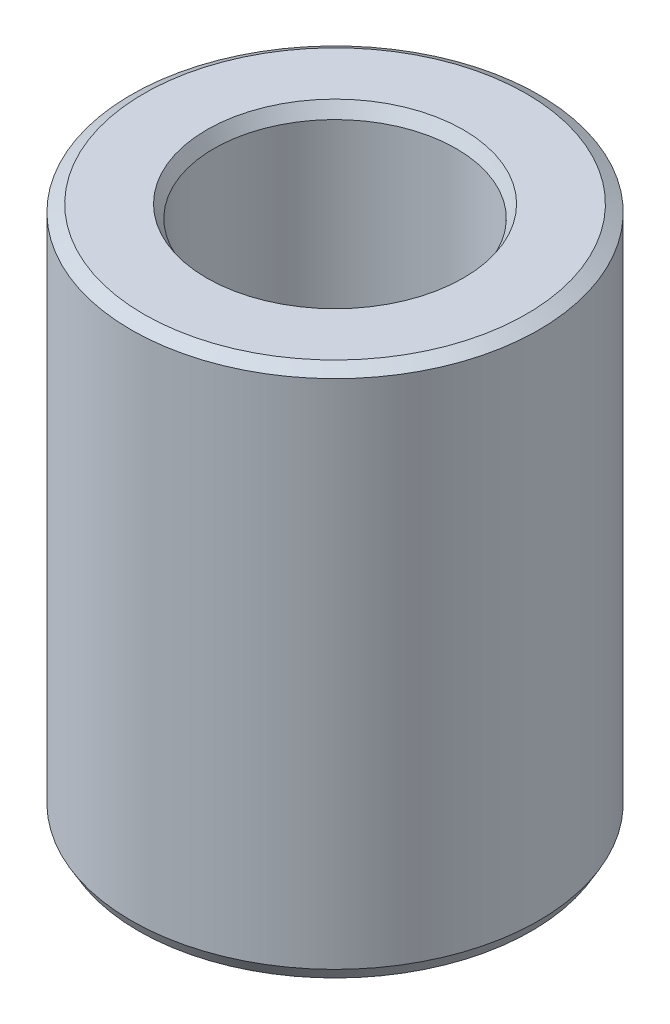
from build123d import *
from OCP.BRepFilletAPI import BRepFilletAPI_MakeChamfer

# Parameters (mm, degrees)
SKETCH1_R           = 60
BOSS_EXTRUDE1_DEPTH = 156.482173439
SKETCH2_R           = 35.663641277
CUT_EXTRUDE1_DEPTH  = 179.007501539
CHAMFER1_SIZE       = 2.138744909
CHAMFER1_SIZE2      = 3.704414846


with BuildPart() as part:
    # Sketch1 → Boss-Extrude1 (new body)
    with BuildSketch(Plane(origin=(0, 0, 0), x_dir=(1, 0, 0), z_dir=(0, 1, 0))):
        Circle(SKETCH1_R)
    extrude(amount=BOSS_EXTRUDE1_DEPTH)

    # Sketch2 → Cut-Extrude1 (cut, through all)
    with BuildSketch(Plane(origin=(0, 0, 0), x_dir=(1, 0, 0), z_dir=(0, 1, 0))):
        Circle(SKETCH2_R)
    extrude(amount=CUT_EXTRUDE1_DEPTH, mode=Mode.SUBTRACT)

    # Chamfer1: one chamfer whose edges measure the first distance from different faces: ONE call of the kernel's chamfer builder (chamfer() names one face for all edges)
    chamfer1_edges_1 = [part.edges().sort_by_distance(p)[0] for p in [
        (-35.663641277, 156.482173439, 0),
    ]]
    chamfer1_side_1 = [part.faces().sort_by_distance(p)[0] for p in [
        (-58.302943725, 156.482173439, 0),
    ]]
    chamfer1_edges_2 = [part.edges().sort_by_distance(p)[0] for p in [
        (-35.663641277, 0, 0),
    ]]
    chamfer1_side_2 = [part.faces().sort_by_distance(p)[0] for p in [
        (-35.663641277, 78.241086719, 0),
    ]]
    chamfer1_edges_3 = [part.edges().sort_by_distance(p)[0] for p in [
        (-60, 0, 0),
    ]]
    chamfer1_side_3 = [part.faces().sort_by_distance(p)[0] for p in [
        (-58.302943725, 0, 0),
    ]]
    chamfer1_edges_4 = [part.edges().sort_by_distance(p)[0] for p in [
        (-60, 156.482173439, 0),
    ]]
    chamfer1_side_4 = [part.faces().sort_by_distance(p)[0] for p in [
        (-60, 78.241086719, 0),
    ]]
    chamfer1 = BRepFilletAPI_MakeChamfer(part.part.solid().wrapped)
    for e in chamfer1_edges_1:
        chamfer1.Add(CHAMFER1_SIZE, CHAMFER1_SIZE2, e.wrapped, chamfer1_side_1[0].wrapped)  # the first distance lies on this face
    for e in chamfer1_edges_2:
        chamfer1.Add(CHAMFER1_SIZE, CHAMFER1_SIZE2, e.wrapped, chamfer1_side_2[0].wrapped)  # the first distance lies on this face
    for e in chamfer1_edges_3:
        chamfer1.Add(CHAMFER1_SIZE, CHAMFER1_SIZE2, e.wrapped, chamfer1_side_3[0].wrapped)  # the first distance lies on this face
    for e in chamfer1_edges_4:
        chamfer1.Add(CHAMFER1_SIZE, CHAMFER1_SIZE2, e.wrapped, chamfer1_side_4[0].wrapped)  # the first distance lies on this face
    add(Compound.cast(chamfer1.Shape()), mode=Mode.REPLACE)


solid = part.part
